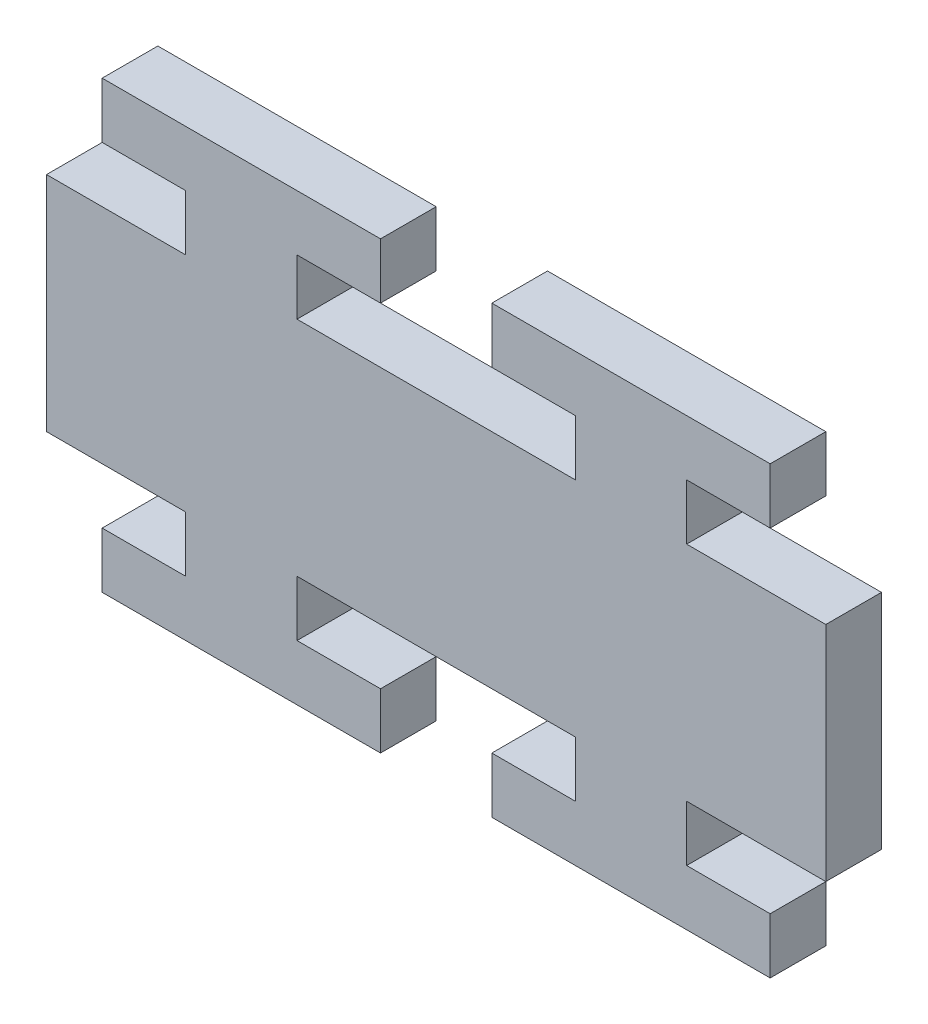
from build123d import *

# Parameters (mm, degrees)
BOSS_EXTRU_1_DEPTH = 5


with BuildPart() as part:
    # Esquisse1 → Boss.-Extru.1 (new body)
    with BuildSketch(Plane.XY):
        Polygon((-35, -10), (-22.5, -10), (-22.5, -15), (-30, -15), (-30, -20), (-5, -20), (-5, -15), (-12.5, -15), (-12.5, -10), (12.5, -10), (12.5, -15), (5, -15), (5, -20), (30, -20), (30, -15), (22.5, -15), (22.5, -10), (35, -10), (35, 10), (22.5, 10), (22.5, 15), (30, 15), (30, 20), (5, 20), (5, 15), (12.5, 15), (12.5, 10), (-12.5, 10), (-12.5, 15), (-5, 15), (-5, 20), (-30, 20), (-30, 15), (-22.5, 15), (-22.5, 10), (-35, 10), align=None)
    extrude(amount=BOSS_EXTRU_1_DEPTH)


solid = part.part
